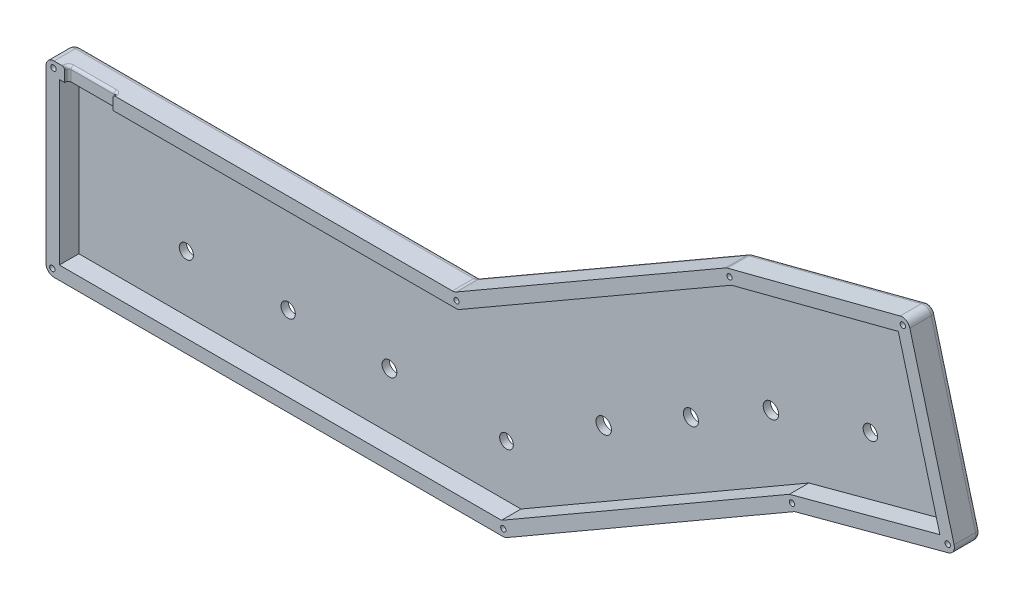
from build123d import *

# Parameters (mm, degrees)
BOSS_EXTRU_1_DEPTH      = 10
CONG_1_R                = 3
BOSS_EXTRU_2_DEPTH      = 2.7
CONG_2_R                = 2
ESQUISSE3_R             = 1
ENL_V_MAT_EXTRU_1_DEPTH = 20
ESQUISSE4_R             = 2
ENL_V_MAT_EXTRU_2_DEPTH = 2
ENL_V_MAT_EXTRU_3_DEPTH = 10
CONG_3_R                = 1
ESQUISSE7_R             = 2.65750741
ESQUISSE7_R_2           = 2.681341543
ESQUISSE7_R_3           = 2.762481607
ESQUISSE7_R_4           = 2.559988112
ESQUISSE7_R_5           = 2.892870985
ESQUISSE7_R_6           = 2.822195531
ESQUISSE7_R_7           = 2.888855657
ESQUISSE7_R_8           = 2.695814163
ENL_V_MAT_EXTRU_4_DEPTH = 10


with BuildPart() as part:
    # Model → Boss.-Extru.1 (new body)
    with BuildSketch(Plane.XY):
        Polygon((75.33141454, 71.077500491), (-26.464533767, 12.30154537), (-179.373873722, 12.291034855), (-179.373873722, -50.687645053), (-179.373873722, -57.858487698), (-7.520422715, -57.858487698), (100.854480283, 4.809102496), (161.383942986, 21.020985262), (143.246352653, 88.745859712), align=None)
        Polygon((-174.373873722, 7.291378528), (-25.124548608, 7.301637465), (77.245358051, 66.408990356), (139.700811798, 82.657041562), (155.26069475, 24.557200291), (98.923133978, 9.468053786), (-8.861972593, -52.858487698), (-174.373873722, -52.858487698), (-174.373873722, -50.687645053), align=None, mode=Mode.SUBTRACT)
    extrude(amount=BOSS_EXTRU_1_DEPTH)

    # Congé1
    cong_1_edges = [part.edges().sort_by_distance(p)[0] for p in [
        (-26.464533767, 12.30154537, 5),
        (75.33141454, 71.077500491, 5),
        (143.246352653, 88.745859712, 5),
        (161.383942986, 21.020985262, 5),
        (100.854480283, 4.809102496, 5),
        (-7.520422715, -57.858487698, 5),
        (-179.373873722, -57.858487698, 5),
        (-179.373873722, 12.291034855, 5),
    ]]
    fillet(cong_1_edges, radius=CONG_1_R)

    # Esquisse1 → Boss.-Extru.2 (add)
    with BuildSketch(Plane.XY):
        Polygon((-25.124548608, 7.301637465), (-174.373873722, 7.291378528), (-174.373873722, -50.687645053), (-174.373873722, -52.858487698), (-8.861972593, -52.858487698), (98.923133978, 9.468053786), (155.26069475, 24.557200291), (139.700811798, 82.657041562), (77.245358051, 66.408990356), align=None)
    extrude(amount=BOSS_EXTRU_2_DEPTH)

    # Congé2
    cong_2_edges = [part.edges().sort_by_distance(p)[0] for p in [
        (100.86445313, 4.78504518, 0),
        (46.843967712, -26.422377988, 0),
        (-7.547920203, -57.756003669, 0),
        (-92.349613182, -57.858487698, 0),
        (-178.495194066, -56.979808041, 0),
        (-179.373873722, -22.78362332, 0),
        (-178.495266971, 11.412488494, 0),
        (-101.821199292, 12.296365586, 0),
        (-26.491925042, 12.40375087, 0),
        (24.605627892, 41.788942262, 0),
        (75.341794938, 71.05218052, 0),
        (108.044083383, 79.587840046, 0),
        (142.628648998, 87.685066626, 0),
        (152.312387337, 54.893729991, 0),
        (160.307894606, 21.642410085, 0),
        (129.861641055, 12.578223, 0),
    ]]
    fillet(cong_2_edges, radius=CONG_2_R)

    # Esquisse3 → Enlèv. mat.-Extru.1 (cut)
    with BuildSketch(Plane.XY):
        with Locations((158.201617013, 22.958080812)):
            Circle(ESQUISSE3_R)
        with Locations((141.388472611, 85.534334234)):
            Circle(ESQUISSE3_R)
        with Locations((76.500226548, 68.776582274)):
            Circle(ESQUISSE3_R)
        with Locations((99.890442316, 7.071415488)):
            Circle(ESQUISSE3_R)
        with Locations((-8.172352823, -55.275906246)):
            Circle(ESQUISSE3_R)
        with Locations((-25.691359515, 9.920090126)):
            Circle(ESQUISSE3_R)
        with Locations((-176.562127678, 9.920090126)):
            Circle(ESQUISSE3_R)
        with Locations((-177.029598341, -55.275906246)):
            Circle(ESQUISSE3_R)
    extrude(amount=ENL_V_MAT_EXTRU_1_DEPTH, mode=Mode.SUBTRACT)

    # Esquisse4 → Enlèv. mat.-Extru.2 (cut)
    with BuildSketch(Plane(origin=(0, 0, 0), x_dir=(-1, 0, 0), z_dir=(0, 0, -1))):
        with Locations((177.029598341, -55.275906246)):
            Circle(ESQUISSE4_R)
        with Locations((176.562127678, 9.920090126)):
            Circle(ESQUISSE4_R)
        with Locations((25.691359515, 9.920090126)):
            Circle(ESQUISSE4_R)
        with Locations((-76.500226548, 68.776582274)):
            Circle(ESQUISSE4_R)
        with Locations((-141.388472611, 85.534334234)):
            Circle(ESQUISSE4_R)
        with Locations((-158.201617013, 22.958080812)):
            Circle(ESQUISSE4_R)
        with Locations((-99.890442316, 7.071415488)):
            Circle(ESQUISSE4_R)
        with Locations((8.172352823, -55.275906246)):
            Circle(ESQUISSE4_R)
    extrude(amount=-ENL_V_MAT_EXTRU_2_DEPTH, mode=Mode.SUBTRACT)

    # Esquisse5 → Enlèv. mat.-Extru.3 (cut)
    with BuildSketch(Plane(origin=(-0.000845695, 12.303364402, 0), x_dir=(0.9999999976376189, 6.873690724146591e-05, 0), z_dir=(-6.873690724146591e-05, 0.9999999976376189, 0))):
        with BuildLine():
            Line((-171.373234654, -8.6), (-155.373234654, -8.6))
            ThreePointArc((-155.373234654, -8.6), (-154.666127873, -8.892893219), (-154.373234654, -9.6))
            Line((-154.373234654, -9.6), (-154.373234654, -18.1))
            Line((-154.373234654, -18.1), (-172.373234654, -18.1))
            Line((-172.373234654, -18.1), (-172.373234654, -9.6))
            ThreePointArc((-172.373234654, -9.6), (-172.080341436, -8.892893219), (-171.373234654, -8.6))
        make_face()
    extrude(amount=-ENL_V_MAT_EXTRU_3_DEPTH, mode=Mode.SUBTRACT)

    # Congé3
    cong_3_edges = [part.edges().sort_by_distance(p)[0] for p in [
        (-154.374079985, 12.292753263, 9.8),
        (-154.666973203, 12.292733131, 8.892893219),
        (-172.374079942, 12.291515999, 9.8),
        (-172.081186724, 12.291536132, 8.892893219),
        (-163.374079964, 12.292134631, 8.6),
    ]]
    fillet(cong_3_edges, radius=CONG_3_R)

    # Esquisse7 → Enlèv. mat.-Extru.4 (cut)
    with BuildSketch(Plane.XY.offset(2.7)):
        with Locations((-134.139415228, -31.92796207)):
            Circle(ESQUISSE7_R)
        with Locations((-96.026166098, -31.92796207)):
            Circle(ESQUISSE7_R_2)
        with Locations((-58.108516881, -31.92796207)):
            Circle(ESQUISSE7_R_3)
        with Locations((-14.286642136, -33.554221842)):
            Circle(ESQUISSE7_R_4)
        with Locations((22.111860424, -10.281429931)):
            Circle(ESQUISSE7_R_5)
        with Locations((54.747815884, 8.693369357)):
            Circle(ESQUISSE7_R_6)
        with Locations((84.710887014, 25.97627725)):
            Circle(ESQUISSE7_R_7)
        with Locations((121.937628237, 37.358287764)):
            Circle(ESQUISSE7_R_8)
    extrude(amount=-ENL_V_MAT_EXTRU_4_DEPTH, mode=Mode.SUBTRACT)


solid = part.part
